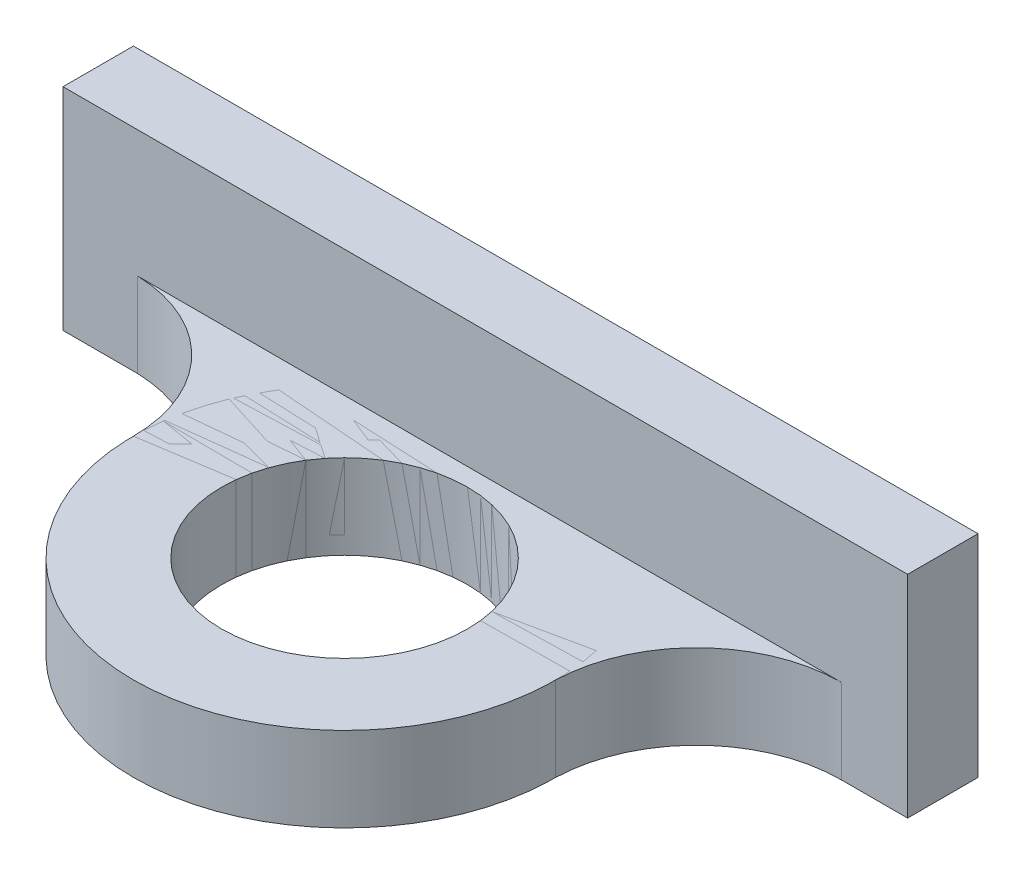
from build123d import *

# Parameters (mm, degrees)
SKETCH1_R           = 30
SKETCH1_R_2         = 17.4625
BOSS_EXTRUDE1_DEPTH = 12
BOSS_EXTRUDE2_DEPTH = 30
BOSS_EXTRUDE3_DEPTH = 12


with BuildPart() as part:
    # Sketch1 → Boss-Extrude1 (new body)
    with BuildSketch(Plane(origin=(0, 0, 0), x_dir=(1, 0, 0), z_dir=(0, 1, 0))):
        Circle(SKETCH1_R)
        Circle(SKETCH1_R_2, mode=Mode.SUBTRACT)
    extrude(amount=BOSS_EXTRUDE1_DEPTH)

    # Sketch5 → Boss-Extrude2 (add)
    with BuildSketch(Plane.XZ):
        Polygon((0, -30), (60, -30), (60, -20), (0, -20), (-60, -20), (-60, -30), align=None)
    extrude(amount=-BOSS_EXTRUDE2_DEPTH)


with BuildPart() as body_2:
    # Sketch6 → Boss-Extrude3 (new body)
    with BuildSketch(Plane.XZ):
        with BuildLine():
            Line((-17.4625, 0), (-30, 0))
            ThreePointArc((-30, 0), (-35.6561489, -13.940933049), (-49.426745923, -20))
            Line((-49.426745923, -20), (50.590169944, -20))
            ThreePointArc((50.590169944, -20), (36.237860911, -14.176946646), (30, 0))
            Line((30, 0), (17.4625, 0))
            ThreePointArc((17.4625, 0), (0, -17.4625), (-17.4625, 0))
        make_face()
    extrude(amount=-BOSS_EXTRUDE3_DEPTH)


solid = Compound([part.part, body_2.part])
